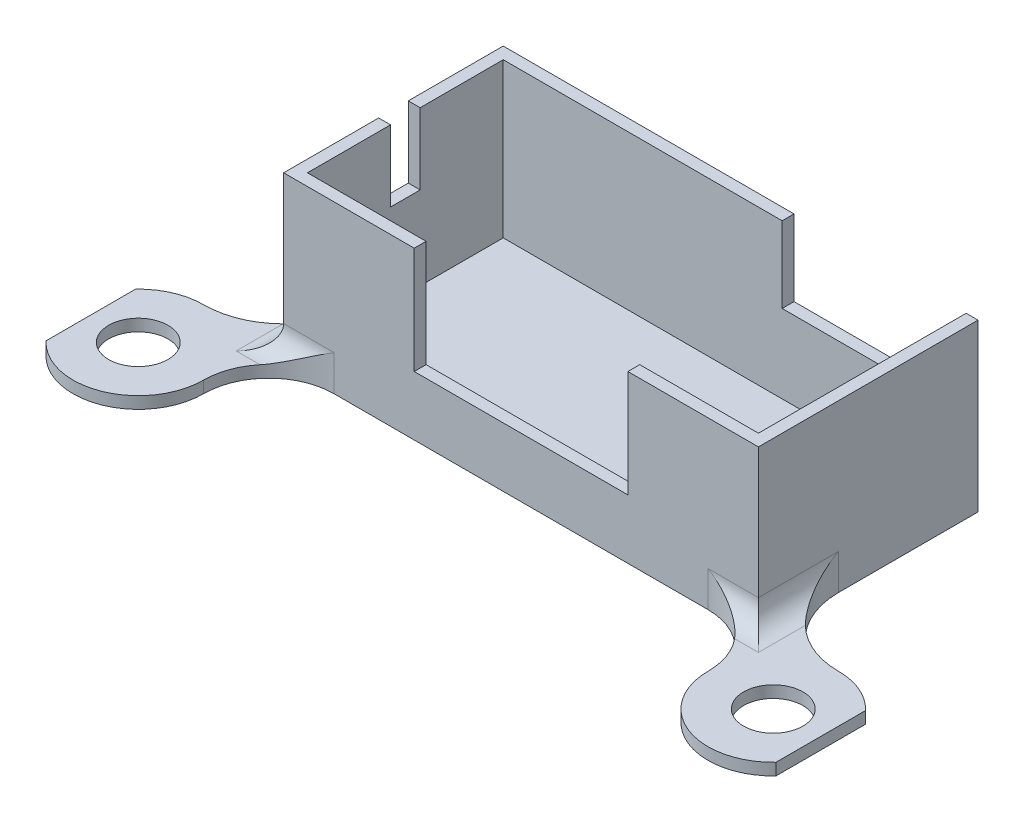
from build123d import *

# Parameters (mm, degrees)
SKETCH1_R           = 1.250000000000001
BOSS_EXTRUDE1_DEPTH = 0.5
SKETCH2_W           = 20
SKETCH2_H           = 9.249999999999996
SKETCH2_W_2         = 19
SKETCH2_H_2         = 8.25
BOSS_EXTRUDE2_DEPTH = 6.5
CUT_EXTRUDE1_REACH  = 24.427
CUT_EXTRUDE2_REACH  = 30.929
SKETCH4_W           = 1.2500000000000009
SKETCH4_H           = 2.999999999999999
FILLET1_R           = 1
CUT_EXTRUDE3_REACH  = 21.26


with BuildPart() as part:
    # Sketch1 → Boss-Extrude1 (new body)
    with BuildSketch(Plane(origin=(0, 0, 0), x_dir=(1, 0, 0), z_dir=(0, 1, 0))):
        with BuildLine():
            Line((10.000000000000002, 12), (-9.999999999999998, 12))
            Line((-9.999999999999998, 12), (-9.999999999999996, 6.124999999999997))
            ThreePointArc((-10, 6.124999999999997), (-10.9885146134954, 3.7385146134953993), (-13.374999999999998, 2.7499999999999982))
            ThreePointArc((-13.374999999999998, 2.7499999999999982), (-14.464033706032863, 2.5251743676673724), (-15.374999999999996, 1.8874586088176866))
            Line((-15.374999999999998, 1.887458608817687), (-15.374999999999998, -1.887458608817687))
            ThreePointArc((-15.374999999999996, -1.8874586088176861), (-12.359495199420504, -2.5556310375326072), (-10.625, -6.7e-16))
            ThreePointArc((-10.624999999999998, 0), (-9.819543648263004, 1.944543648263008), (-7.8749999999999964, 2.7500000000000027))
            Line((-7.8749999999999964, 2.749999999999996), (7.874999999999998, 2.749999999999998))
            ThreePointArc((7.8749999999999964, 2.7500000000000027), (9.819543648263004, 1.944543648263008), (10.624999999999998, 0))
            ThreePointArc((10.625, 3.4e-16), (12.359495199420502, -2.555631037532607), (15.374999999999996, -1.887458608817686))
            Line((15.374999999999998, -1.887458608817687), (15.374999999999998, 1.887458608817687))
            ThreePointArc((15.374999999999996, 1.8874586088176861), (14.464033706032865, 2.525174367667372), (13.374999999999998, 2.7499999999999982))
            ThreePointArc((13.374999999999998, 2.7499999999999982), (10.9885146134954, 3.7385146134953993), (10, 6.124999999999997))
            Line((9.999999999999996, 6.124999999999997), (10.000000000000002, 12))
        make_face()
        with Locations((13.374999999999998, 0)):
            Circle(SKETCH1_R, mode=Mode.SUBTRACT)
        with Locations((-13.374999999999998, 0)):
            Circle(SKETCH1_R, mode=Mode.SUBTRACT)
    extrude(amount=BOSS_EXTRUDE1_DEPTH)

    # Sketch2 → Boss-Extrude2 (add)
    with BuildSketch(Plane(origin=(0, 0.5, 0), x_dir=(1, 0, 0), z_dir=(0, 1, 0))):
        with Locations((1.78e-15, 7.375000000000002)):
            Rectangle(SKETCH2_W, SKETCH2_H)
        with Locations((2.66e-15, 7.375)):
            Rectangle(SKETCH2_W_2, SKETCH2_H_2, mode=Mode.SUBTRACT)
    extrude(amount=BOSS_EXTRUDE2_DEPTH)

    # Sketch3 → Cut-Extrude1 (cut, up to next)
    with BuildSketch(Plane(origin=(0, 0, -12), x_dir=(-1, 0, 0), z_dir=(0, 0, -1)), mode=Mode.PRIVATE) as cut_extrude1_sk1:
        Polygon((-2.2500000000000053, 6.999999999999999), (-9.500000000000005, 6.999999999999999), (-9.500000000000005, 3.8), (-2.2500000000000044, 3.8), align=None)
    cut_extrude1_tool1 = extrude(cut_extrude1_sk1.sketch, amount=-CUT_EXTRUDE1_REACH, mode=Mode.PRIVATE) & part.part
    add(cut_extrude1_tool1.solids().sort_by_distance((5.875, 5.4, -12))[0], mode=Mode.SUBTRACT)

    # Sketch4 → Cut-Extrude2 (cut, up to next)
    with BuildSketch(Plane.ZY.offset(9.999999999999993), mode=Mode.PRIVATE) as cut_extrude2_sk1:
        with Locations((-7.375000000000005, 5.5)):
            Rectangle(SKETCH4_W, SKETCH4_H)
    cut_extrude2_tool1 = extrude(cut_extrude2_sk1.sketch, amount=-CUT_EXTRUDE2_REACH, mode=Mode.PRIVATE) & part.part
    add(cut_extrude2_tool1.solids().sort_by_distance((-10, 5.5, -7.375))[0], mode=Mode.SUBTRACT)

    # Fillet1
    fillet1_edges = [part.edges().sort_by_distance(p)[0] for p in [
        (-9.999999999999998, 0.5, -4.4375),
        (-8.937499999999998, 0.5, -2.7500000000000027),
        (8.9375, 0.5, -2.7500000000000027),
        (10.000000000000002, 0.5, -4.4375),
    ]]
    fillet(fillet1_edges, radius=FILLET1_R)

    # Sketch5 → Cut-Extrude3 (cut, up to next)
    with BuildSketch(Plane.XY.offset(-2.749999999999997), mode=Mode.PRIVATE) as cut_extrude3_sk1:
        Polygon((4.499999999999998, 6.999999999999999), (-4.499999999999999, 6.999999999999999), (-4.5, 2.499999999999999), (4.5, 2.5), align=None)
    cut_extrude3_tool1 = extrude(cut_extrude3_sk1.sketch, amount=-CUT_EXTRUDE3_REACH, mode=Mode.PRIVATE) & part.part
    add(cut_extrude3_tool1.solids().sort_by_distance((0, 4.75, -2.75))[0], mode=Mode.SUBTRACT)


solid = part.part
